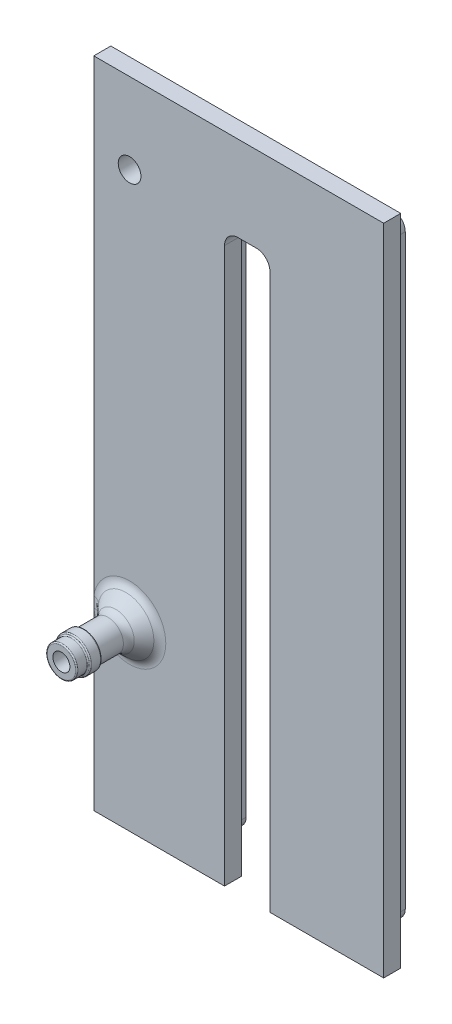
from build123d import *

# Parameters (mm, degrees)
BOSS_EXTRUDE1_DEPTH = 4
BOSS_EXTRUDE2_DEPTH = 3
SKETCH2_R           = 1.5
CUT_EXTRUDE1_DEPTH  = 128.51415942
SKETCH3_R           = 5.5
SKETCH5_R           = 2.7
SKETCH5_35_R        = 2.7
SKETCH5_35_R_2      = 1.5
BOSS_EXTRUDE3_DEPTH = 9
SKETCH6_R           = 2
CUT_EXTRUDE2_DEPTH  = 129.731739881
BOSS_EXTRUDE4_START = -2
SKETCH4_R           = 3.1
SKETCH4_R_2         = 2.7
BOSS_EXTRUDE4_DEPTH = 2
FILLET1_R           = 2
FILLET2_R           = 0.2
SKETCH3_52_R        = 1.5
CUT_EXTRUDE3_DEPTH  = 128.886124648


with BuildPart() as part:
    # Sketch1 → Boss-Extrude1 (new body)
    with BuildSketch(Plane.XY):
        with BuildLine():
            Line((-20.870387638, -15.841379094), (-20.870387638, -119.041379094))
            ThreePointArc((-20.870387638, -119.041379094), (-20.226022556, -120.597014012), (-18.670387638, -121.241379094))
            Line((-18.670387638, -121.241379094), (-6.470387638, -121.241379094))
            ThreePointArc((-6.470387638, -121.241379094), (-4.914752719, -120.597014012), (-4.270387638, -119.041379094))
            Line((-4.270387638, -119.041379094), (-4.270387638, -20.241379094))
            Line((-4.270387638, -20.241379094), (10.129612362, -20.241379094))
            Line((10.129612362, -20.241379094), (10.129612362, -119.041379094))
            ThreePointArc((10.129612362, -119.041379094), (10.773977444, -120.597014012), (12.329612362, -121.241379094))
            Line((12.329612362, -121.241379094), (21.529612362, -121.241379094))
            ThreePointArc((21.529612362, -121.241379094), (23.085247281, -120.597014012), (23.729612362, -119.041379094))
            Line((23.729612362, -119.041379094), (23.729612362, -15.841379094))
            ThreePointArc((23.729612362, -15.841379094), (23.085247281, -14.285744175), (21.529612362, -13.641379094))
            Line((21.529612362, -13.641379094), (21.329612362, -13.641379094))
            ThreePointArc((21.329612362, -13.641379094), (19.773977444, -14.285744175), (19.129612362, -15.841379094))
            Line((19.129612362, -15.841379094), (19.129612362, -114.641379094))
            Line((19.129612362, -114.641379094), (16.729612362, -114.641379094))
            Line((16.729612362, -114.641379094), (16.729612362, -15.841379094))
            ThreePointArc((16.729612362, -15.841379094), (16.085247281, -14.285744175), (14.529612362, -13.641379094))
            Line((14.529612362, -13.641379094), (-9.670387638, -13.641379094))
            ThreePointArc((-9.670387638, -13.641379094), (-11.226022556, -14.285744175), (-11.870387638, -15.841379094))
            Line((-11.870387638, -15.841379094), (-11.870387638, -112.641379094))
            Line((-11.870387638, -112.641379094), (-14.270387638, -112.641379094))
            Line((-14.270387638, -112.641379094), (-14.270387638, -15.841379094))
            ThreePointArc((-14.270387638, -15.841379094), (-14.914752719, -14.285744175), (-16.470387638, -13.641379094))
            Line((-16.470387638, -13.641379094), (-18.670387638, -13.641379094))
            ThreePointArc((-18.670387638, -13.641379094), (-20.226022556, -14.285744175), (-20.870387638, -15.841379094))
        make_face()
    extrude(amount=-BOSS_EXTRUDE1_DEPTH)

    # Sketch1<3> → Boss-Extrude2 (add)
    with BuildSketch(Plane.XY):
        with BuildLine():
            Line((26.929612362, -9.441379094), (-24.070387638, -9.441379094))
            Line((-24.070387638, -9.441379094), (-24.070387638, -124.441379094))
            Line((-24.070387638, -124.441379094), (-1.070387638, -124.441379094))
            Line((-1.070387638, -124.441379094), (-1.070387638, -26.841379094))
            ThreePointArc((-1.070387638, -26.841379094), (-0.367443913, -25.144322819), (1.329612362, -24.441379094))
            Line((1.329612362, -24.441379094), (4.529612362, -24.441379094))
            ThreePointArc((4.529612362, -24.441379094), (6.226668637, -25.144322819), (6.929612362, -26.841379094))
            Line((6.929612362, -26.841379094), (6.929612362, -124.441379094))
            Line((6.929612362, -124.441379094), (26.929612362, -124.441379094))
            Line((26.929612362, -124.441379094), (26.929612362, -9.441379094))
        make_face()
    extrude(amount=BOSS_EXTRUDE2_DEPTH)

    # Sketch2 → Cut-Extrude1 (cut, through all)
    with BuildSketch(Plane(origin=(0, 0, -4), x_dir=(-1, 0, 0), z_dir=(0, 0, -1))):
        with Locations((17.770387638, -92.641379094)):
            Circle(SKETCH2_R)
    extrude(amount=-CUT_EXTRUDE1_DEPTH, mode=Mode.SUBTRACT)

    # Sketch3 → Loft2 section 0
    with BuildSketch(Plane.XY.offset(3)):
        with Locations((-17.770387638, -92.641379094)):
            Circle(SKETCH3_R)
    # Sketch5 → Loft2 section 1
    with BuildSketch(Plane.XY.offset(6)):
        with Locations((-17.770387638, -92.641379094)):
            Circle(SKETCH5_R)
    loft()

    # Sketch5<35> → Boss-Extrude3 (add)
    with BuildSketch(Plane.XY.offset(6)):
        with Locations((-17.770387638, -92.641379094)):
            Circle(SKETCH5_35_R)
        with Locations(Location((-17.770387638, -92.641379094, 0), (0, 0, 180))):
            Circle(SKETCH5_35_R_2, mode=Mode.SUBTRACT)
    extrude(amount=BOSS_EXTRUDE3_DEPTH)

    # Sketch6 → Cut-Extrude2 (cut, through all)
    with BuildSketch(Plane(origin=(0, 0, -4), x_dir=(-1, 0, 0), z_dir=(0, 0, -1))):
        with Locations((17.770387638, -23.641379094)):
            Circle(SKETCH6_R)
    extrude(amount=-CUT_EXTRUDE2_DEPTH, mode=Mode.SUBTRACT)

    # Sketch4 → Boss-Extrude4 (add)
    with BuildSketch(Plane.XY.offset(13).offset(BOSS_EXTRUDE4_START)):
        with Locations((-17.770387638, -92.641379094)):
            Circle(SKETCH4_R)
        with Locations((-17.770387638, -92.641379094)):
            Circle(SKETCH4_R_2, mode=Mode.SUBTRACT)
    extrude(amount=BOSS_EXTRUDE4_DEPTH)

    # Fillet1
    fillet1_edges = [part.edges().sort_by_distance(p)[0] for p in [
        (-20.470387638, -92.641379094, 6),
        (-23.270387638, -92.641379094, 3),
    ]]
    fillet(fillet1_edges, radius=FILLET1_R)

    # Fillet2
    fillet2_edges = [part.edges().sort_by_distance(p)[0] for p in [
        (-20.470387638, -92.641379094, 15),
        (-20.470387638, -92.641379094, 11),
        (-20.870387638, -92.641379094, 11),
        (-20.870387638, -92.641379094, 13),
        (-20.470387638, -92.641379094, 13),
    ]]
    fillet(fillet2_edges, radius=FILLET2_R - 0.0001)  # a hair under: the kernel refuses the full size

    # Sketch3<52> → Cut-Extrude3 (cut, through all)
    with BuildSketch(Plane.XY.offset(3)):
        with Locations(Location((-17.770387638, -92.641379094, 0), (0, 0, 180))):
            Circle(SKETCH3_52_R)
    extrude(amount=CUT_EXTRUDE3_DEPTH, mode=Mode.SUBTRACT)


solid = part.part
